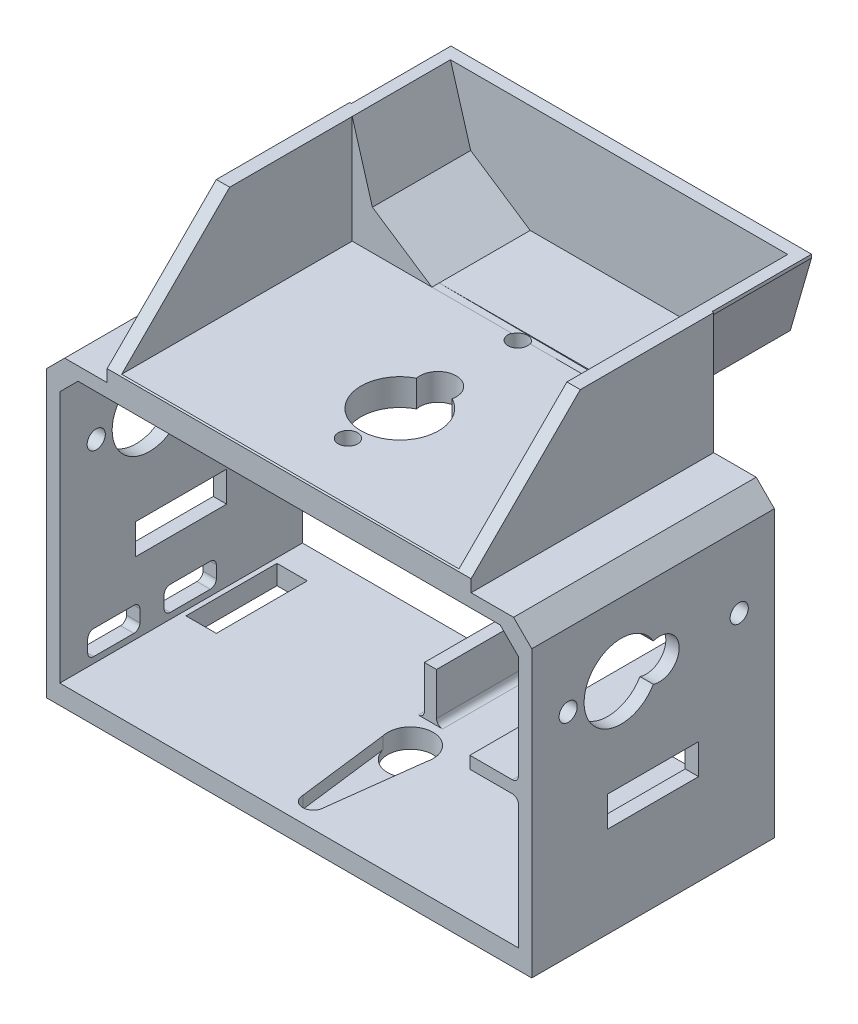
from build123d import *

# Parameters (mm, degrees)
SKETCH1_W               = 80
SKETCH1_H               = 60
SKETCH1_W_2             = 75.6
SKETCH1_H_2             = 55.6
BOSS_EXTRUDE1_DEPTH     = 40
CHAMFER1_SIZE           = 18
SKETCH2_W               = 60
SKETCH2_H               = 20
BOSS_EXTRUDE2_DEPTH     = 1.8
SKETCH5_W               = 80
SKETCH5_H               = 50
SKETCH5_W_2             = 75.6
SKETCH5_H_2             = 45.6
BOSS_EXTRUDE3_DEPTH     = 40
SKETCH6_W               = 80
SKETCH6_H               = 10
CUT_EXTRUDE3_DEPTH      = 40
SKETCH7_R               = 1.6
SKETCH7_R_2             = 6.4
SKETCH7_R_3             = 3
CUT_EXTRUDE4_DEPTH      = 40
CUT_EXTRUDE5_DEPTH      = 101.761302096
CUT_EXTRUDE5_DEPTH_BACK = 40
SKETCH3_R               = 1.5
SKETCH4_R               = 3.25
SKETCH4_R_2             = 6.125
CUT_EXTRUDE6_DEPTH      = 103.46950766
SKETCH10_W              = 80
SKETCH10_H              = 40
BOSS_EXTRUDE4_DEPTH     = 1
SKETCH12_W              = 15
SKETCH12_H              = 5
CUT_EXTRUDE10_DEPTH     = 103.46950766
SKETCH13_W              = 5
SKETCH13_H              = 15
CUT_EXTRUDE11_DEPTH     = 10
CUT_EXTRUDE12_DEPTH     = 75.560311158
BOSS_EXTRUDE5_START     = -1.2
BOSS_EXTRUDE5_DEPTH     = 15
BOSS_EXTRUDE8_DEPTH     = 2
CHAMFER2_SIZE           = 3
CHAMFER3_SIZE           = 3
CUT_EXTRUDE15_START     = -1.2
CUT_EXTRUDE15_DEPTH     = 2.2
CUT_EXTRUDE16_START     = -2.2
SKETCH26_R              = 3.75
CUT_EXTRUDE16_DEPTH     = 2.2
BOSS_EXTRUDE9_START     = -25
SKETCH27_W              = 2
SKETCH27_H              = 8
BOSS_EXTRUDE9_DEPTH     = 15
FILLET1_R               = 1
SKETCH28_W              = 8
SKETCH28_H              = 2
BOSS_EXTRUDE10_DEPTH    = 40
FILLET2_R               = 1
CUT_EXTRUDE17_DEPTH     = 101.761302096


with BuildPart() as part:
    # Sketch1 → Boss-Extrude1 (new body)
    # profile 1 of 2: a face of its own
    with BuildSketch(Plane.XY):
        Polygon((-30, 50), (-30, 30), (30, 30), (30, 50), (27.8, 50), (27.8, 47.8), (27.8, 32.2), (-27.8, 32.2), (-27.8, 47.8), (-27.8, 50), align=None)
    # profile 2 of 2: a face of its own
    with BuildSketch(Plane.XY):
        Rectangle(SKETCH1_W, SKETCH1_H)
        Rectangle(SKETCH1_W_2, SKETCH1_H_2, mode=Mode.SUBTRACT)
    extrude(amount=BOSS_EXTRUDE1_DEPTH)

    # Chamfer1
    # the kernel refuses this chamfer: 18 mm, written as the material it takes off along each edge
    with BuildSketch(Plane(origin=(76.290293783, 50, 40), x_dir=(0, -0.9996219169112966, 0.02749587661058639), z_dir=(-1, 0, 0)), Plane(origin=(18.490293783, 50, 40), x_dir=(0, -0.9996219169112966, 0.02749587661058639), z_dir=(-1, 0, 0))) as chamfer1_piece_1:
        Polygon((CHAMFER1_SIZE * 0.999621916911, -CHAMFER1_SIZE * 0.0274958766106), (-CHAMFER1_SIZE * 0.0274958766106, -CHAMFER1_SIZE * 0.999621916911), (0, 0), align=None)
    extrude(amount=94.780587567, mode=Mode.SUBTRACT)

    # Sketch2 → Boss-Extrude2 (add)
    with BuildSketch(Plane(origin=(0, 0, 0), x_dir=(-1, 0, 0), z_dir=(0, 0, -1))):
        with Locations((0, 40)):
            Rectangle(SKETCH2_W, SKETCH2_H)
    extrude(amount=-BOSS_EXTRUDE2_DEPTH)

    # Sketch5 → Boss-Extrude3 (add)
    with BuildSketch(Plane.XY.offset(40)):
        with Locations((0, 5)):
            Rectangle(SKETCH5_W, SKETCH5_H)
        with Locations((0, 5)):
            Rectangle(SKETCH5_W_2, SKETCH5_H_2, mode=Mode.SUBTRACT)
    extrude(amount=-BOSS_EXTRUDE3_DEPTH)

    # Sketch6 → Cut-Extrude3 (cut)
    with BuildSketch(Plane.XY.offset(40)):
        with Locations((0, -25)):
            Rectangle(SKETCH6_W, SKETCH6_H)
    extrude(amount=-CUT_EXTRUDE3_DEPTH, mode=Mode.SUBTRACT)

    # Sketch7 → Cut-Extrude4 (cut)
    with BuildSketch(Plane.XZ.offset(-27.8)):
        with Locations((0, 2.3)):
            Circle(SKETCH7_R)
        with Locations((0, 21.75)):
            Circle(SKETCH7_R_2)
        with Locations((0, 15.45)):
            Circle(SKETCH7_R_3)
        with Locations((0, 30.3)):
            Circle(SKETCH7_R)
    extrude(amount=-CUT_EXTRUDE4_DEPTH, mode=Mode.SUBTRACT)

    # Sketch3 → Cut-Extrude5 (cut, two sides: drawn at the far end of the back side and taken through both)
    with BuildSketch(Plane.ZY.offset(-37.8).offset(-CUT_EXTRUDE5_DEPTH_BACK)):
        with Locations((34, 15)):
            Circle(SKETCH3_R)
        with Locations((5.8, 15)):
            Circle(SKETCH3_R)
    extrude(amount=CUT_EXTRUDE5_DEPTH + CUT_EXTRUDE5_DEPTH_BACK, mode=Mode.SUBTRACT)

    # Sketch4 → Cut-Extrude6 (cut, through all)
    with BuildSketch(Plane(origin=(40, 0, 0), x_dir=(0, 0, -1), z_dir=(1, 0, 0))):
        with Locations((-18.95, 15)):
            Circle(SKETCH4_R)
        with Locations((-25.25, 15)):
            Circle(SKETCH4_R_2)
    extrude(amount=-CUT_EXTRUDE6_DEPTH, mode=Mode.SUBTRACT)

    # Sketch10 → Boss-Extrude4 (add)
    with BuildSketch(Plane(origin=(0, -17.8, 0), x_dir=(1, 0, 0), z_dir=(0, 1, 0))):
        with Locations((0, -20)):
            Rectangle(SKETCH10_W, SKETCH10_H)
    extrude(amount=BOSS_EXTRUDE4_DEPTH)

    # Sketch12 → Cut-Extrude10 (cut, through all)
    with BuildSketch(Plane.ZY.offset(40)):
        with Locations((20, -2.5)):
            Rectangle(SKETCH12_W, SKETCH12_H)
    extrude(amount=-CUT_EXTRUDE10_DEPTH, mode=Mode.SUBTRACT)

    # Sketch13 → Cut-Extrude11 (cut)
    with BuildSketch(Plane.XZ.offset(20)):
        with Locations((-34.5, 12.5)):
            Rectangle(SKETCH13_W, SKETCH13_H)
        with Locations((34.5, 12.5)):
            Rectangle(SKETCH13_W, SKETCH13_H)
    extrude(amount=-CUT_EXTRUDE11_DEPTH, mode=Mode.SUBTRACT)

    # Sketch14 → Cut-Extrude12 (cut, through all)
    with BuildSketch(Plane.XY.offset(1.8)):
        Polygon((-27.8, 50), (-24.469302189, 38.708703588), (-14.659934208, 32.2), (14.659934208, 32), (24.505699212, 38.608703588), (27.8, 50), align=None)
    extrude(amount=-CUT_EXTRUDE12_DEPTH, mode=Mode.SUBTRACT)

    # Sketch15 → Boss-Extrude5 (add)
    with BuildSketch(Plane.XY.offset(1.8).offset(BOSS_EXTRUDE5_START)):
        Polygon((27.8, 50), (24.505699212, 38.608703588), (14.957897791, 32.2), (-14.659934208, 32.2), (-24.469302189, 38.708703588), (-27.8, 50), (-29.718283002, 50), (-29.718283002, 49.434146376), (-26.181631315, 37.44465205), (-15.765700543, 30.53348243), (16.07253082, 30.539399744), (26.224741306, 37.353796576), (29.721271707, 49.444378702), (29.721271707, 50), align=None)
    extrude(amount=-BOSS_EXTRUDE5_DEPTH)

    # Sketch22 → Boss-Extrude8 (add)
    with BuildSketch(Plane(origin=(0, 0, -14.4), x_dir=(-1, 0, 0), z_dir=(0, 0, -1))):
        Polygon((-26.224741306, 37.353796576), (-16.07253082, 30.539399744), (15.765700543, 30.53348243), (26.181631315, 37.44465205), (29.718283002, 49.434146376), (29.718283002, 50), (27.8, 50), (24.469302189, 38.708703588), (14.659934208, 32.2), (-14.957897791, 32.2), (-24.505699212, 38.608703588), (-27.8, 50), (-29.721271707, 50), (-29.721271707, 49.444378702), align=None)
        Polygon((-27.8, 50), (27.8, 50), (24.469302189, 38.708703588), (14.659934208, 32.2), (-14.957897791, 32.2), (-24.505699212, 38.608703588), align=None)
    extrude(amount=BOSS_EXTRUDE8_DEPTH)

    # Chamfer2
    chamfer2_edges = [part.edges().sort_by_distance(p)[0] for p in [
        (37.8, 27.8, 20),
        (-37.8, 27.8, 20),
    ]]
    chamfer(chamfer2_edges, length=CHAMFER2_SIZE)

    # Chamfer3
    chamfer3_edges = [part.edges().sort_by_distance(p)[0] for p in [
        (40, 30, 20),
        (-40, 30, 20),
    ]]
    chamfer(chamfer3_edges, length=CHAMFER3_SIZE)

    # Sketch25 → Cut-Extrude15 (cut)
    with BuildSketch(Plane.XZ.offset(20).offset(CUT_EXTRUDE15_START)):
        with BuildLine():
            Line((-3.634615385, 20.923076923), (-1.75, 36))
            ThreePointArc((-1.75, 36), (0, 37.75), (1.75, 36))
            Line((1.75, 36), (3.634615385, 20.923076923))
            ThreePointArc((3.634615385, 20.923076923), (0, 16.25), (-3.634615385, 20.923076923))
        make_face()
    extrude(amount=-CUT_EXTRUDE15_DEPTH, mode=Mode.SUBTRACT)

    # Sketch26 → Cut-Extrude16 (cut)
    with BuildSketch(Plane(origin=(0, -18.8, 0), x_dir=(1, 0, 0), z_dir=(0, 1, 0)).offset(CUT_EXTRUDE16_START)):
        with Locations(Location((0, -20, 0), (0, 0, 90))):
            Circle(SKETCH26_R)
    extrude(amount=CUT_EXTRUDE16_DEPTH, mode=Mode.SUBTRACT)

    # Sketch27 → Boss-Extrude9 (add)
    with BuildSketch(Plane.XY.offset(40).offset(BOSS_EXTRUDE9_START)):
        with Locations((-1.7, -12.8)):
            Rectangle(SKETCH27_W, SKETCH27_H)
    extrude(amount=-BOSS_EXTRUDE9_DEPTH)

    # Fillet1
    fillet1_edges = [part.edges().sort_by_distance(p)[0] for p in [
        (-0.7, -16.8, 7.5),
        (-2.7, -16.8, 7.5),
    ]]
    fillet(fillet1_edges, radius=FILLET1_R)

    # Sketch28 → Boss-Extrude10 (add)
    with BuildSketch(Plane.XY.offset(40)):
        with Locations((33.8, 5.7)):
            Rectangle(SKETCH28_W, SKETCH28_H)
    extrude(amount=-BOSS_EXTRUDE10_DEPTH)

    # Fillet2
    fillet2_edges = [part.edges().sort_by_distance(p)[0] for p in [
        (37.8, 6.7, 20),
        (37.8, 4.7, 20),
    ]]
    fillet(fillet2_edges, radius=FILLET2_R)

    # Sketch29 → Cut-Extrude17 (cut, through all)
    with BuildSketch(Plane(origin=(-37.8, 0, 0), x_dir=(0, 0, -1), z_dir=(1, 0, 0))):
        with BuildLine():
            Line((-34.4, -11.8), (-27.8, -11.8))
            ThreePointArc((-27.8, -11.8), (-27.092893219, -12.092893219), (-26.8, -12.8))
            Line((-26.8, -12.8), (-26.8, -14.8))
            ThreePointArc((-26.8, -14.8), (-27.092893219, -15.507106781), (-27.8, -15.8))
            Line((-27.8, -15.8), (-34.4, -15.8))
            ThreePointArc((-34.4, -15.8), (-35.107106781, -15.507106781), (-35.4, -14.8))
            Line((-35.4, -14.8), (-35.4, -12.8))
            ThreePointArc((-35.4, -12.8), (-35.107106781, -12.092893219), (-34.4, -11.8))
        make_face()
        with BuildLine():
            Line((-21.8, -11.8), (-15.2, -11.8))
            ThreePointArc((-15.2, -11.8), (-14.492893219, -12.092893219), (-14.2, -12.8))
            Line((-14.2, -12.8), (-14.2, -14.8))
            ThreePointArc((-14.2, -14.8), (-14.492893219, -15.507106781), (-15.2, -15.8))
            Line((-15.2, -15.8), (-21.8, -15.8))
            ThreePointArc((-21.8, -15.8), (-22.507106781, -15.507106781), (-22.8, -14.8))
            Line((-22.8, -14.8), (-22.8, -12.8))
            ThreePointArc((-22.8, -12.8), (-22.507106781, -12.092893219), (-21.8, -11.8))
        make_face()
    extrude(amount=-CUT_EXTRUDE17_DEPTH, mode=Mode.SUBTRACT)


solid = part.part
